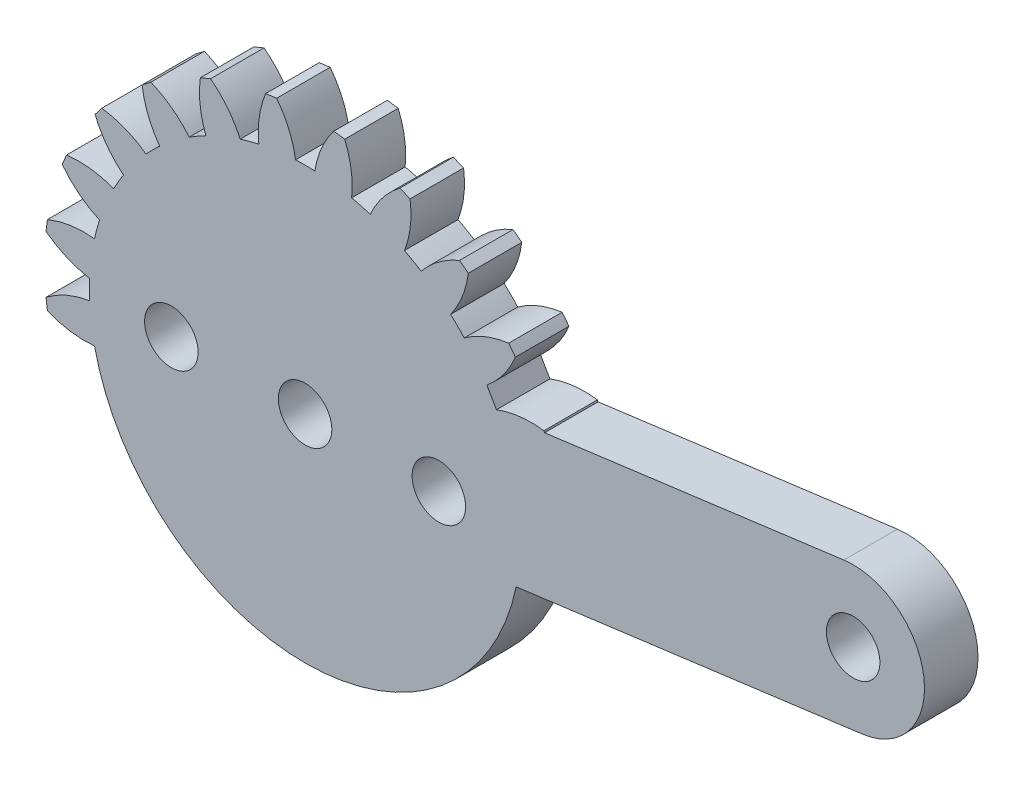
from build123d import *

# Parameters (mm, degrees)
BOSS_EXTRUDE1_START     = -3
BOSS_EXTRUDE1_OUTLINE_R = 1.5
BOSS_EXTRUDE1_DEPTH     = 3
SCALE1_SCALE            = 1.9


# Read off the part's stored shape, not the designer's step: Boss-Extrude1
with BuildPart() as part:
    # Boss-Extrude1 outline → Boss-Extrude1 (new body)
    with BuildSketch(Plane.XY.offset(BOSS_EXTRUDE1_START)):
        with BuildLine():
            Line((11.834550238, -2.472148997), (31.252104769, 0.084220555))
            ThreePointArc((31.252104769, 0.084220555), (34.695779445, 4.572104769), (30.207895231, 8.015779445))
            Line((30.207895231, 8.015779445), (13.427938823, 5.806656275))
            ThreePointArc((13.427938823, 5.806656275), (13.410760304, 5.846221532), (13.393465207, 5.885735968))
            ThreePointArc((13.393465207, 5.885735968), (12.041551488, 5.897071585), (10.729192217, 5.572244952))
            Line((10.729192217, 5.572244952), (10.189200244, 6.507557022))
            ThreePointArc((10.189200244, 6.507557022), (11.126720661, 7.481723913), (11.792869471, 8.658240563))
            ThreePointArc((11.792869471, 8.658240563), (11.606759368, 8.906179706), (11.415437385, 9.150119633))
            ThreePointArc((11.415437385, 9.150119633), (10.106597569, 8.81117421), (8.922976471, 8.15773197))
            ThreePointArc((8.922976471, 8.15773197), (8.549706323, 8.548135574), (8.159371308, 8.921477448))
            ThreePointArc((8.159371308, 8.921477448), (8.812813548, 10.105098546), (9.151758972, 11.413938362))
            Line((9.151758972, 11.413938362), (8.659879901, 11.791370448))
            ThreePointArc((8.659879901, 11.791370448), (7.483516811, 11.125336137), (6.509436976, 10.187999326))
            ThreePointArc((6.509436976, 10.187999326), (6.047829045, 10.468613272), (5.574146563, 10.728326528))
            ThreePointArc((5.574146563, 10.728326528), (5.898805358, 12.040487702), (5.887415057, 13.392168338))
            Line((5.887415057, 13.392168338), (5.314609747, 13.629432066))
            ThreePointArc((5.314609747, 13.629432066), (4.351003751, 12.681995862), (3.65280527, 11.524977816))
            ThreePointArc((3.65280527, 11.524977816), (3.134170467, 11.676689406), (2.609274564, 11.805074597))
            ThreePointArc((2.609274564, 11.805074597), (2.58305967, 13.15599481), (2.222297371, 14.458117388))
            Line((2.222297371, 14.458117388), (1.607601557, 14.539043627))
            ThreePointArc((1.607601557, 14.539043627), (0.922327421, 13.375148622), (0.547316802, 12.077605074))
            ThreePointArc((0.547316802, 12.077605074), (0.006856042, 12.089998056), (-0.533618427, 12.078218055))
            ThreePointArc((-0.533618427, 12.078218055), (-0.908651119, 13.375486662), (-1.593822374, 14.539142845))
            Line((-1.593822374, 14.539142845), (-2.208518188, 14.458216606))
            ThreePointArc((-2.208518188, 14.458216606), (-2.569071942, 13.157522433), (-2.595800172, 11.808044777))
            ThreePointArc((-2.595800172, 11.808044777), (-3.121351418, 11.680122659), (-3.640655008, 11.528821757))
            ThreePointArc((-3.640655008, 11.528821757), (-4.338480819, 12.683812024), (-5.300881923, 13.629722958))
            Line((-5.300881923, 13.629722958), (-5.873687233, 13.39245923))
            ThreePointArc((-5.873687233, 13.39245923), (-5.885433032, 12.043808909), (-5.562611018, 10.734312212))
            ThreePointArc((-5.562611018, 10.734312212), (-6.037455135, 10.474599539), (-6.500199913, 10.193895285))
            ThreePointArc((-6.500199913, 10.193895285), (-7.47268922, 11.127885908), (-8.646251294, 11.791833189))
            Line((-8.646251294, 11.791833189), (-9.138130365, 11.414401103))
            ThreePointArc((-9.138130365, 11.414401103), (-8.80083054, 10.109699304), (-8.150983569, 8.92914144))
            ThreePointArc((-8.150983569, 8.92914144), (-8.542690029, 8.555147402), (-8.917254459, 8.163986338))
            ThreePointArc((-8.917254459, 8.163986338), (-10.097571821, 8.813551755), (-11.401949093, 9.15072269))
            Line((-11.401949093, 9.15072269), (-11.779381179, 8.658843619))
            ThreePointArc((-11.779381179, 8.658843619), (-11.116550367, 7.486781519), (-10.184349411, 6.515145975))
            ThreePointArc((-10.184349411, 6.515145975), (-10.46607819, 6.052215075), (-10.726778871, 5.577124264))
            ThreePointArc((-10.726778871, 5.577124264), (-12.034053776, 5.89841947), (-13.38017907, 5.886378776))
            Line((-13.38017907, 5.886378776), (-13.617442798, 5.313573465))
            ThreePointArc((-13.617442798, 5.313573465), (-12.674640857, 4.353631081), (-11.523783462, 3.656571444))
            ThreePointArc((-11.523783462, 3.656571444), (-11.67614775, 3.13618777), (-11.805025713, 2.60949572))
            ThreePointArc((-11.805025713, 2.60949572), (-13.149945407, 2.581153618), (-14.44612812, 2.221261089))
            Line((-14.44612812, 2.221261089), (-14.527054359, 1.606565275))
            ThreePointArc((-14.527054359, 1.606565275), (-13.368714152, 0.923687604), (-12.07756623, 0.548173302))
            ThreePointArc((-12.07756623, 0.548173302), (-12.089998597, 0.005825389), (-12.07808888, -0.536534252))
            ThreePointArc((-12.07808888, -0.536534252), (-13.369010177, -0.912066026), (-14.527153576, -1.594858655))
            Line((-14.527153576, -1.594858655), (-14.446227337, -2.20955447))
            ThreePointArc((-14.446227337, -2.20955447), (-13.151251636, -2.569269431), (-11.807551859, -2.598041398))
            ThreePointArc((-11.807551859, -2.598041398), (0.06437742, -12.089828599), (11.834550238, -2.472148997))
        make_face()
        with Locations((-7.5, 0)):
            Circle(BOSS_EXTRUDE1_OUTLINE_R, mode=Mode.SUBTRACT)
        Circle(BOSS_EXTRUDE1_OUTLINE_R, mode=Mode.SUBTRACT)
        with Locations((7.5, 0)):
            Circle(BOSS_EXTRUDE1_OUTLINE_R, mode=Mode.SUBTRACT)
        with Locations((30.73, 4.05)):
            Circle(BOSS_EXTRUDE1_OUTLINE_R, mode=Mode.SUBTRACT)
    extrude(amount=BOSS_EXTRUDE1_DEPTH)


with BuildPart() as part_1:
    # Scale1: scaled about (5.663998646, 1.349090427, -1.5)
    add(part.part.scale(SCALE1_SCALE).moved(Location((-5.097598781, -1.214181384, 1.35))))


solid = part_1.part
